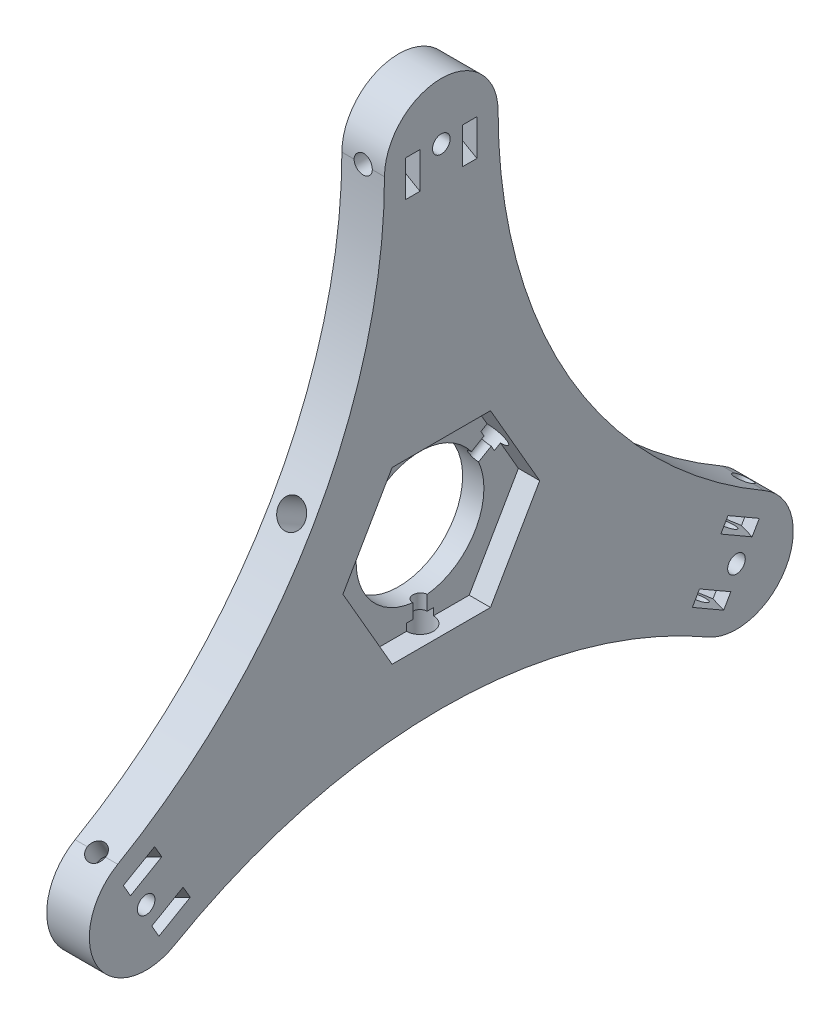
from build123d import *

# Parameters (mm, degrees)
SKETCH1_R                   = 1.9685
BOSS_EXTRUDE1_DEPTH         = 9.525
SKETCH3_R                   = 1.6
CUT_EXTRUDE1_DEPTH          = 121.530179668
CUT_EXTRUDE3_START          = -11.1125
SKETCH5_R                   = 2.999994
CUT_EXTRUDE3_DEPTH          = 110.417679676
CIRPATTERN9_COUNT           = 3
CUT_EXTRUDE2_START          = -3.175
CUT_EXTRUDE2_DEPTH          = 3.2
SKETCH6_R                   = 2.032
CUT_EXTRUDE4_DEPTH          = 120.105963224
CUT_EXTRUDE5_START          = -4.7625
CUT_EXTRUDE5_DEPTH          = 3.2
CIRPATTERN1_COUNT           = 3
CIRPATTERN1_COPY_1_SKETCH_R = 2.032
CIRPATTERN1_COPY_1_DEPTH    = 120.105963224
CIRPATTERN1_COPY_2_SKETCH_R = 2.032
CIRPATTERN1_COPY_2_DEPTH    = 120.105963224
CIRPATTERN1_START           = -4.7625
CIRPATTERN1_COPY_3_DEPTH    = 3.2
CIRPATTERN1_COPY_4_DEPTH    = 3.2
CIRPATTERN1_COPY_5_SKETCH_R = 2.032
CIRPATTERN1_COPY_5_DEPTH    = 120.105963224
CIRPATTERN1_COPY_6_SKETCH_R = 2.032
CIRPATTERN1_COPY_6_DEPTH    = 120.105963224
SKETCH8_R                   = 14.2875
CUT_EXTRUDE6_DEPTH          = 120.105963364
CUT_EXTRUDE7_DEPTH          = 4.7625


with BuildPart() as part:
    # Sketch1 → Boss-Extrude1 (new body)
    with BuildSketch(Plane(origin=(0, 0, 0), x_dir=(0, 0, -1), z_dir=(1, 0, 0))):
        with BuildLine():
            ThreePointArc((72.341135768, -27.101477372), (28.680794165, 16.558864232), (12.7, 76.2))
            ThreePointArc((12.7, 76.2), (0, 88.9), (-12.7, 76.2))
            ThreePointArc((-12.7, 76.2), (-28.680794165, 16.558864232), (-72.341135768, -27.101477372))
            ThreePointArc((-72.341135768, -27.101477372), (-76.989658396, -44.45), (-59.641135768, -49.098522628))
            ThreePointArc((-59.641135768, -49.098522628), (0, -33.117728463), (59.641135768, -49.098522628))
            ThreePointArc((59.641135768, -49.098522628), (76.989658396, -44.45), (72.341135768, -27.101477372))
        make_face()
        with Locations((-65.991135768, -38.1)):
            Circle(SKETCH1_R, mode=Mode.SUBTRACT)
        Polygon((-7.332348419, 0), (-3.666174209, 6.35), (3.666174209, 6.35), (7.332348419, 0), (3.666174209, -6.35), (-3.666174209, -6.35), align=None, mode=Mode.SUBTRACT)
        with Locations((65.991135768, -38.1)):
            Circle(SKETCH1_R, mode=Mode.SUBTRACT)
        with Locations((0, 76.2)):
            Circle(SKETCH1_R, mode=Mode.SUBTRACT)
    extrude(amount=BOSS_EXTRUDE1_DEPTH)

    # Sketch3 → Cut-Extrude1 (cut, through all)
    with BuildSketch(Plane(origin=(0, 3.175, 5.499261314), x_dir=(-1, 0, 0), z_dir=(0, -0.4999999999999999, -0.8660254037844387))):
        with Locations((-4.7625, 0)):
            Circle(SKETCH3_R)
    cut_extrude1 = extrude(amount=-CUT_EXTRUDE1_DEPTH, mode=Mode.SUBTRACT)

    # Sketch5 → Cut-Extrude3 (cut, through all)
    with BuildSketch(Plane(origin=(0, 3.175, 5.499261314), x_dir=(-1, 0, 0), z_dir=(0, -0.4999999999999999, -0.8660254037844387)).offset(CUT_EXTRUDE3_START)):
        with Locations((-4.7625, 0)):
            Circle(SKETCH5_R)
    cut_extrude3 = extrude(amount=-CUT_EXTRUDE3_DEPTH, mode=Mode.SUBTRACT)

    # CirPattern9: Cut-Extrude1, Cut-Extrude3 ×3 about axis
    cirpattern9_axis = Axis((-0.47625, 0, 0), (1, 0, 0))
    add([cut_extrude1.rotate(cirpattern9_axis, i * 360 / CIRPATTERN9_COUNT) for i in range(1, CIRPATTERN9_COUNT)], mode=Mode.SUBTRACT)
    add([cut_extrude3.rotate(cirpattern9_axis, i * 360 / CIRPATTERN9_COUNT) for i in range(1, CIRPATTERN9_COUNT)], mode=Mode.SUBTRACT)

    # Sketch4 → Cut-Extrude2 (cut)
    with BuildSketch(Plane(origin=(0, 3.175, 5.499261314), x_dir=(-1, 0, 0), z_dir=(0, -0.4999999999999999, -0.8660254037844387)).offset(CUT_EXTRUDE2_START)):
        Polygon((-3.174786782, 2.749999961), (-6.350213218, 2.749999961), (-9.525, 2.749999961), (-9.525, -2.749999961), (-6.350213218, -2.749999961), (-3.174786782, -2.749999961), (-1.587073564, 0), align=None)
    extrude(amount=-CUT_EXTRUDE2_DEPTH, mode=Mode.SUBTRACT)

    # Sketch6 → Cut-Extrude4 (cut, through all)
    with BuildSketch(Plane.XY):
        with Locations((4.7625, 76.2)):
            Circle(SKETCH6_R)
    cut_extrude4 = extrude(amount=-CUT_EXTRUDE4_DEPTH, mode=Mode.SUBTRACT)

    # Sketch7 → Cut-Extrude5 (cut)
    with BuildSketch(Plane.XY.offset(CUT_EXTRUDE5_START)):
        Polygon((8.2625, 78.220725942), (9.525, 77.491821227), (9.525, 69.408917459), (4.7625, 72.158548116), (1.2625, 74.179274058), (1.2625, 78.220725942), (4.7625, 80.241451884), align=None)
    cut_extrude5 = extrude(amount=-CUT_EXTRUDE5_DEPTH, mode=Mode.SUBTRACT)

    # Mirror1: Cut-Extrude4, Cut-Extrude5 across plane
    add(cut_extrude4.mirror(Plane.XY), mode=Mode.SUBTRACT)
    add(cut_extrude5.mirror(Plane.XY), mode=Mode.SUBTRACT)

    # CirPattern1: Cut-Extrude5 ×3 about axis
    cirpattern1_axis = Axis((-0.47625, 0, 0), (1, 0, 0))
    for i in range(1, CIRPATTERN1_COUNT):
        add(cut_extrude5.rotate(cirpattern1_axis, i * 360 / CIRPATTERN1_COUNT), mode=Mode.SUBTRACT)

    # CirPattern1 copy 1 sketch → CirPattern1 copy 1 (cut, through all)
    with BuildSketch(Plane(origin=(0, 0, 0), x_dir=(1, 0, 0), z_dir=(0, 0.8660254037844387, 0.4999999999999998))):
        with Locations((4.7625, -76.2)):
            Circle(CIRPATTERN1_COPY_1_SKETCH_R)
    extrude(amount=-CIRPATTERN1_COPY_1_DEPTH, mode=Mode.SUBTRACT)

    # CirPattern1 copy 2 sketch → CirPattern1 copy 2 (cut, through all)
    with BuildSketch(Plane(origin=(0, 0, 0), x_dir=(1, 0, 0), z_dir=(0, -0.8660254037844384, 0.5000000000000004))):
        with Locations((4.7625, -76.2)):
            Circle(CIRPATTERN1_COPY_2_SKETCH_R)
    extrude(amount=-CIRPATTERN1_COPY_2_DEPTH, mode=Mode.SUBTRACT)

    # CirPattern1 copy 3 sketch → CirPattern1 copy 3 (cut)
    with BuildSketch(Plane(origin=(0, 0, 0), x_dir=(1, 0, 0), z_dir=(0, 0.8660254037844387, 0.4999999999999998)).offset(CIRPATTERN1_START)):
        Polygon((8.2625, -78.220725942), (9.525, -77.491821227), (9.525, -69.408917459), (4.7625, -72.158548116), (1.2625, -74.179274058), (1.2625, -78.220725942), (4.7625, -80.241451884), align=None)
    extrude(amount=-CIRPATTERN1_COPY_3_DEPTH, mode=Mode.SUBTRACT)

    # CirPattern1 copy 4 sketch → CirPattern1 copy 4 (cut)
    with BuildSketch(Plane(origin=(0, 0, 0), x_dir=(1, 0, 0), z_dir=(0, -0.8660254037844384, 0.5000000000000004)).offset(CIRPATTERN1_START)):
        Polygon((8.2625, -78.220725942), (9.525, -77.491821227), (9.525, -69.408917459), (4.7625, -72.158548116), (1.2625, -74.179274058), (1.2625, -78.220725942), (4.7625, -80.241451884), align=None)
    extrude(amount=-CIRPATTERN1_COPY_4_DEPTH, mode=Mode.SUBTRACT)

    # CirPattern1 copy 5 sketch → CirPattern1 copy 5 (cut, through all)
    with BuildSketch(Plane(origin=(0, 0, 0), x_dir=(1, 0, 0), z_dir=(0, -0.8660254037844387, -0.4999999999999998))):
        with Locations((4.7625, 76.2)):
            Circle(CIRPATTERN1_COPY_5_SKETCH_R)
    extrude(amount=-CIRPATTERN1_COPY_5_DEPTH, mode=Mode.SUBTRACT)

    # CirPattern1 copy 6 sketch → CirPattern1 copy 6 (cut, through all)
    with BuildSketch(Plane(origin=(0, 0, 0), x_dir=(1, 0, 0), z_dir=(0, 0.8660254037844384, -0.5000000000000004))):
        with Locations((4.7625, 76.2)):
            Circle(CIRPATTERN1_COPY_6_SKETCH_R)
    extrude(amount=-CIRPATTERN1_COPY_6_DEPTH, mode=Mode.SUBTRACT)

    # Sketch8 → Cut-Extrude6 (cut, through all)
    with BuildSketch(Plane(origin=(9.525, 0, 0), x_dir=(0, 0, -1), z_dir=(1, 0, 0))):
        Circle(SKETCH8_R)
    extrude(amount=-CUT_EXTRUDE6_DEPTH, mode=Mode.SUBTRACT)

    # Sketch9 → Cut-Extrude7 (cut)
    with BuildSketch(Plane(origin=(9.525, 0, 0), x_dir=(0, 0, -1), z_dir=(1, 0, 0))):
        Polygon((-10.998522628, 19.05), (-21.997045256, 0), (-10.998522628, -19.05), (10.998522628, -19.05), (21.997045256, 0), (10.998522628, 19.05), align=None)
    extrude(amount=-CUT_EXTRUDE7_DEPTH, mode=Mode.SUBTRACT)


solid = part.part
